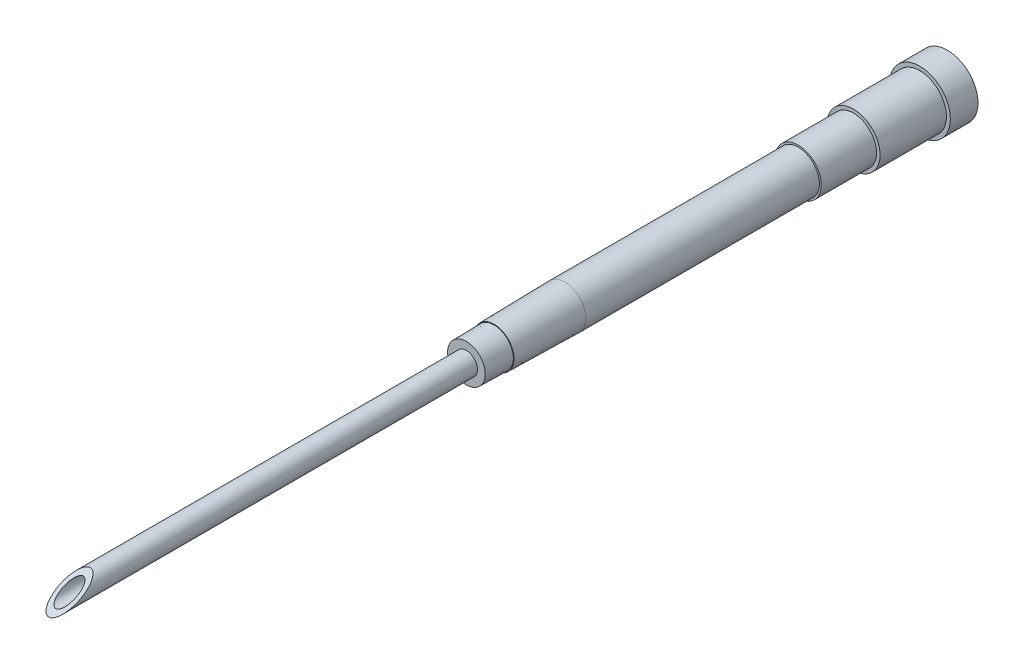
from build123d import *

# Parameters (mm, degrees)
SKETCH1_R           = 5.510734027
BOSS_EXTRUDE1_DEPTH = 5
SKETCH2_R           = 4.80322663
BOSS_EXTRUDE2_DEPTH = 12
SKETCH3_R           = 4.165391046
BOSS_EXTRUDE3_DEPTH = 10
SKETCH4_R           = 3.833295876
BOSS_EXTRUDE4_DEPTH = 15
SKETCH5_R           = 3.610443511
BOSS_EXTRUDE5_DEPTH = 40
SKETCH6_R           = 3.404861597
BOSS_EXTRUDE6_DEPTH = 5
DRAFT3_ANGLE        = 1
SKETCH7_R           = 1.999677314
BOSS_EXTRUDE7_DEPTH = 80
SKETCH8_R           = 1.320990831
CUT_EXTRUDE1_DEPTH  = 170
SKETCH9_W           = 6.196430892
SKETCH9_H           = 6.69100276
BOSS_EXTRUDE8_DEPTH = 5
CUT_EXTRUDE3_DEPTH  = 40


# Read off the part's stored shape, not the designer's step: Draft1
with BuildPart() as part:
    # Sketch1 → Boss-Extrude1 (new body)
    with BuildSketch(Plane.XY):
        Circle(SKETCH1_R)
    extrude(amount=BOSS_EXTRUDE1_DEPTH)

    # Sketch2 → Boss-Extrude2 (add)
    with BuildSketch(Plane.XY.offset(5)):
        Circle(SKETCH2_R)
    extrude(amount=BOSS_EXTRUDE2_DEPTH)

    # Sketch3 → Boss-Extrude3 (add)
    with BuildSketch(Plane.XY.offset(17)):
        Circle(SKETCH3_R)
    extrude(amount=BOSS_EXTRUDE3_DEPTH)

    # Sketch4 → Boss-Extrude4 (add)
    with BuildSketch(Plane.XY.offset(27)):
        Circle(SKETCH4_R)
    extrude(amount=BOSS_EXTRUDE4_DEPTH)

    # Sketch5 → Boss-Extrude5 (add)
    with BuildSketch(Plane.XY.offset(42)):
        Circle(SKETCH5_R)
    extrude(amount=BOSS_EXTRUDE5_DEPTH)

    # Draft1 outline → Draft1 (revolve)
    with BuildSketch(Plane.XZ):
        Polygon((3.833295876, 42), (3.833295876, 69.232796586), (3.610443511, 82), (3.610443511, 42), align=None)
    revolve(axis=Axis((0, 0, 0), (0, 0, 1)))

    # Sketch6 → Boss-Extrude6 (add)
    with BuildSketch(Plane.XY.offset(82)):
        Circle(SKETCH6_R)
    extrude(amount=BOSS_EXTRUDE6_DEPTH)

    # Draft3
    draft3_faces = [part.faces().sort_by_distance(p)[0] for p in [
        (-3.404861597, 0, 84.5),
    ]]
    draft(draft3_faces, Plane.XY.offset(87), DRAFT3_ANGLE)

    # Sketch7 → Boss-Extrude7 (add)
    with BuildSketch(Plane.XY.offset(87)):
        Circle(SKETCH7_R)
    extrude(amount=BOSS_EXTRUDE7_DEPTH)

    # Sketch8 → Cut-Extrude1 (cut)
    with BuildSketch(Plane.XY.offset(167)):
        Circle(SKETCH8_R)
    extrude(amount=-CUT_EXTRUDE1_DEPTH, mode=Mode.SUBTRACT)

    # Sketch9 → Boss-Extrude8 (add)
    with BuildSketch(Plane.XY.offset(167)):
        with Locations((-0.356570781, -0.45222472)):
            Rectangle(SKETCH9_W, SKETCH9_H)
    extrude(amount=BOSS_EXTRUDE8_DEPTH)

    # Sketch10 → Cut-Extrude3 (cut)
    with BuildSketch(Plane(origin=(2.741644665, 0, 0), x_dir=(0, 0, -1), z_dir=(1, 0, 0))):
        Polygon((-152.074864923, 3.565905239), (-141.864160289, 3.91336171), (-152.717774104, 10.240072861), (-183.049805068, 3.30023825), (-173.245812896, -7.716844209), align=None)
    extrude(amount=-CUT_EXTRUDE3_DEPTH, mode=Mode.SUBTRACT)


solid = part.part
